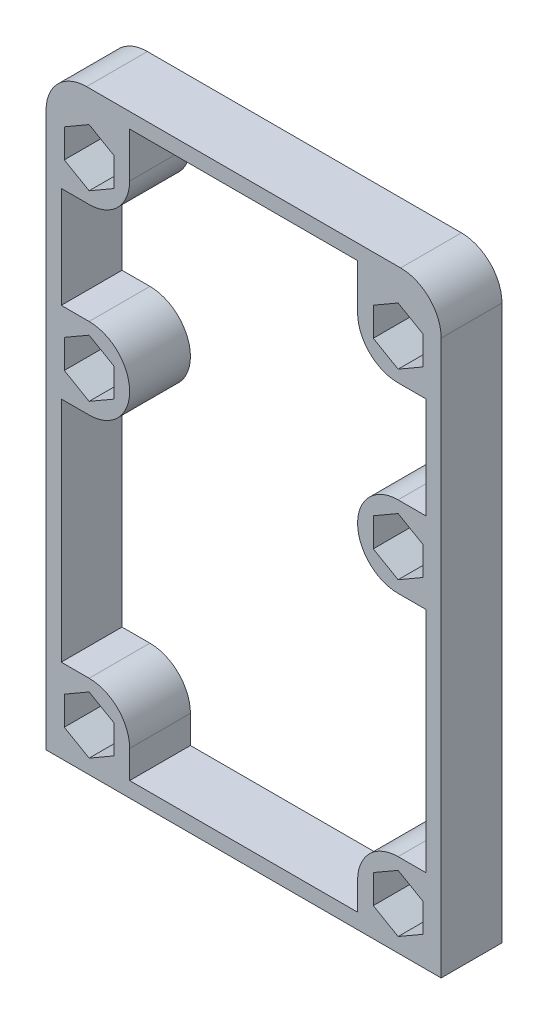
from build123d import *

# Parameters (mm, degrees)
BASE_SHAPE_DEPTH = 6


with BuildPart() as part:
    # Sketch1 → Base shape (new body)
    with BuildSketch(Plane.XY):
        with BuildLine():
            Line((-19.5, 35.2), (-19.5, -19.5))
            Line((-19.5, -19.5), (19.5, -19.5))
            Line((19.5, -19.5), (19.5, 35.2))
            ThreePointArc((19.5, 35.2), (18.328427125, 38.028427125), (15.5, 39.2))
            Line((15.5, 39.2), (-15.5, 39.2))
            ThreePointArc((-15.5, 39.2), (-18.328427125, 38.028427125), (-19.5, 35.2))
        make_face()
        with BuildLine():
            Line((11.25, -18), (-11.25, -18))
            Line((-11.25, -18), (-11.25, -15.25))
            ThreePointArc((-11.25, -15.25), (-12.421572875, -12.421572875), (-15.25, -11.25))
            Line((-15.25, -11.25), (-18, -11.25))
            Line((-18, -11.25), (-18, 11.25))
            Line((-18, 11.25), (-15.25, 11.25))
            ThreePointArc((-15.25, 11.25), (-11.25, 15.25), (-15.25, 19.25))
            Line((-15.25, 19.25), (-18, 19.25))
            Line((-18, 19.25), (-18, 29.25))
            Line((-18, 29.25), (-15.25, 29.25))
            ThreePointArc((-15.25, 29.25), (-12.421572875, 30.421572875), (-11.25, 33.25))
            Line((-11.25, 33.25), (-11.25, 37.7))
            Line((-11.25, 37.7), (11.25, 37.7))
            Line((11.25, 37.7), (11.25, 33.25))
            ThreePointArc((11.25, 33.25), (12.421572875, 30.421572875), (15.25, 29.25))
            Line((15.25, 29.25), (18, 29.25))
            Line((18, 29.25), (18, 19.25))
            Line((18, 19.25), (15.25, 19.25))
            ThreePointArc((15.25, 19.25), (11.25, 15.25), (15.25, 11.25))
            Line((15.25, 11.25), (18, 11.25))
            Line((18, 11.25), (18, -11.25))
            Line((18, -11.25), (15.25, -11.25))
            ThreePointArc((15.25, -11.25), (12.421572875, -12.421572875), (11.25, -15.25))
            Line((11.25, -15.25), (11.25, -18))
        make_face(mode=Mode.SUBTRACT)
        Polygon((15.25, -18.079016319), (12.8, -16.66450816), (12.8, -13.83549184), (15.25, -12.420983681), (17.7, -13.83549184), (17.7, -16.66450816), align=None, mode=Mode.SUBTRACT)
        Polygon((-15.25, -18.079016319), (-17.7, -16.66450816), (-17.7, -13.83549184), (-15.25, -12.420983681), (-12.8, -13.83549184), (-12.8, -16.66450816), align=None, mode=Mode.SUBTRACT)
        Polygon((15.25, 12.420983681), (12.8, 13.83549184), (12.8, 16.66450816), (15.25, 18.079016319), (17.7, 16.66450816), (17.7, 13.83549184), align=None, mode=Mode.SUBTRACT)
        Polygon((15.25, 36.079016319), (17.7, 34.66450816), (17.7, 31.83549184), (15.25, 30.420983681), (12.8, 31.83549184), (12.8, 34.66450816), align=None, mode=Mode.SUBTRACT)
        Polygon((-17.7, 31.83549184), (-17.7, 34.66450816), (-15.25, 36.079016319), (-12.8, 34.66450816), (-12.8, 31.83549184), (-15.25, 30.420983681), align=None, mode=Mode.SUBTRACT)
        Polygon((-17.7, 13.83549184), (-17.7, 16.66450816), (-15.25, 18.079016319), (-12.8, 16.66450816), (-12.8, 13.83549184), (-15.25, 12.420983681), align=None, mode=Mode.SUBTRACT)
    extrude(amount=BASE_SHAPE_DEPTH)


solid = part.part
